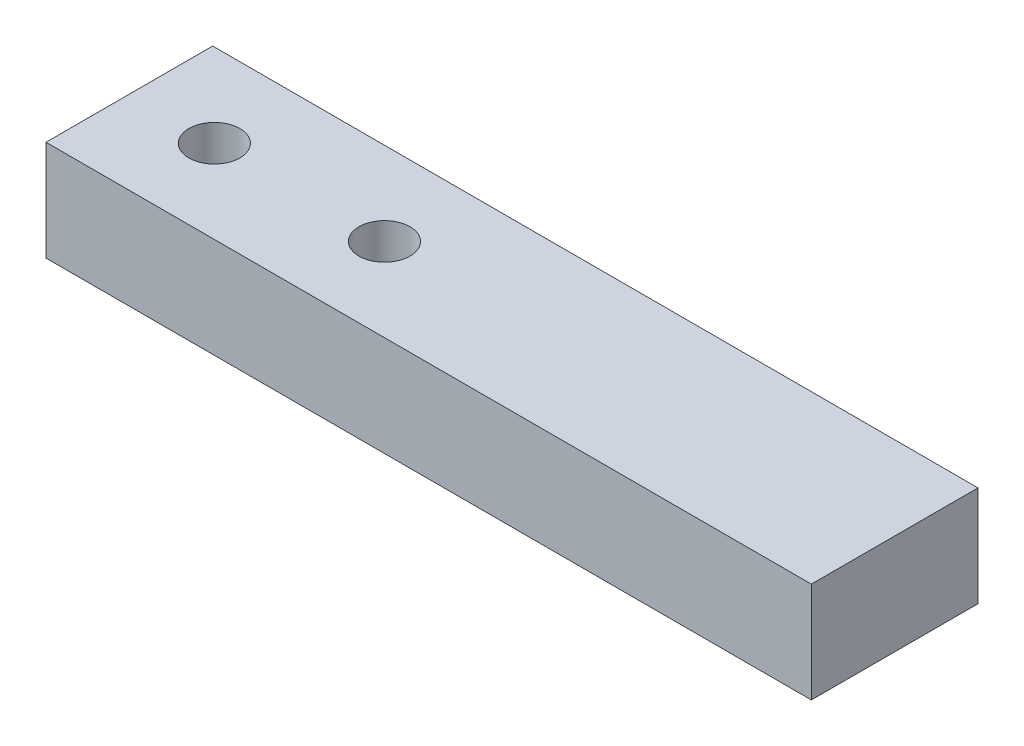
from build123d import *

# Parameters (mm, degrees)
SKETCH1_W           = 45
SKETCH1_H           = 9.8
SKETCH1_R           = 1.5
BOSS_EXTRUDE1_DEPTH = 5.9


with BuildPart() as part:
    # Sketch1 → Boss-Extrude1 (new body)
    with BuildSketch(Plane(origin=(0, 0, 0), x_dir=(1, 0, 0), z_dir=(0, 1, 0))):
        Rectangle(SKETCH1_W, SKETCH1_H)
        with Locations((-17.5, 0)):
            Circle(SKETCH1_R, mode=Mode.SUBTRACT)
        with Locations((-7.5, 0)):
            Circle(SKETCH1_R, mode=Mode.SUBTRACT)
    extrude(amount=BOSS_EXTRUDE1_DEPTH)


solid = part.part
